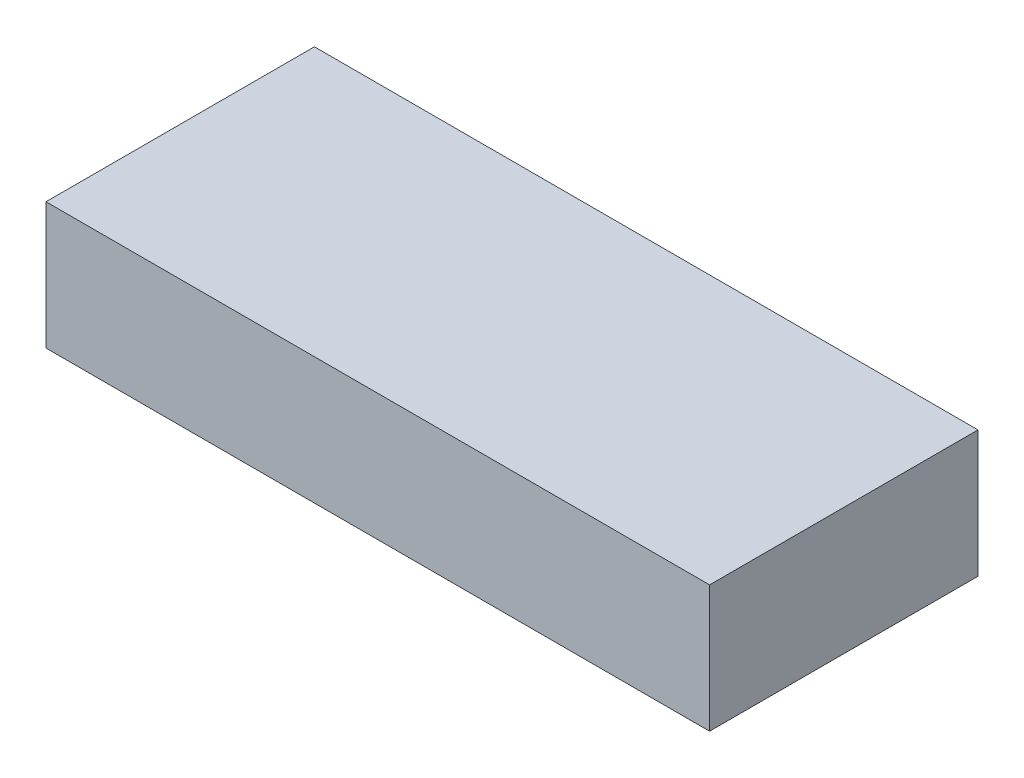
from build123d import *

# Parameters (mm, degrees)
CROQUIS1_W              = 89
CROQUIS1_H              = 36
SALIENTE_EXTRUIR1_DEPTH = 4.6
CROQUIS2_W              = 89
CROQUIS2_H              = 36
SALIENTE_EXTRUIR2_DEPTH = 12.4


with BuildPart() as part:
    # Croquis1 → Saliente-Extruir1 (new body)
    with BuildSketch(Plane(origin=(0, 0, 0), x_dir=(1, 0, 0), z_dir=(0, 1, 0))):
        Rectangle(CROQUIS1_W, CROQUIS1_H)
    extrude(amount=SALIENTE_EXTRUIR1_DEPTH)

    # Croquis2 → Saliente-Extruir2 (add)
    with BuildSketch(Plane(origin=(0, 4.6, 0), x_dir=(1, 0, 0), z_dir=(0, 1, 0))):
        Rectangle(CROQUIS2_W, CROQUIS2_H)
    extrude(amount=SALIENTE_EXTRUIR2_DEPTH)


solid = part.part
